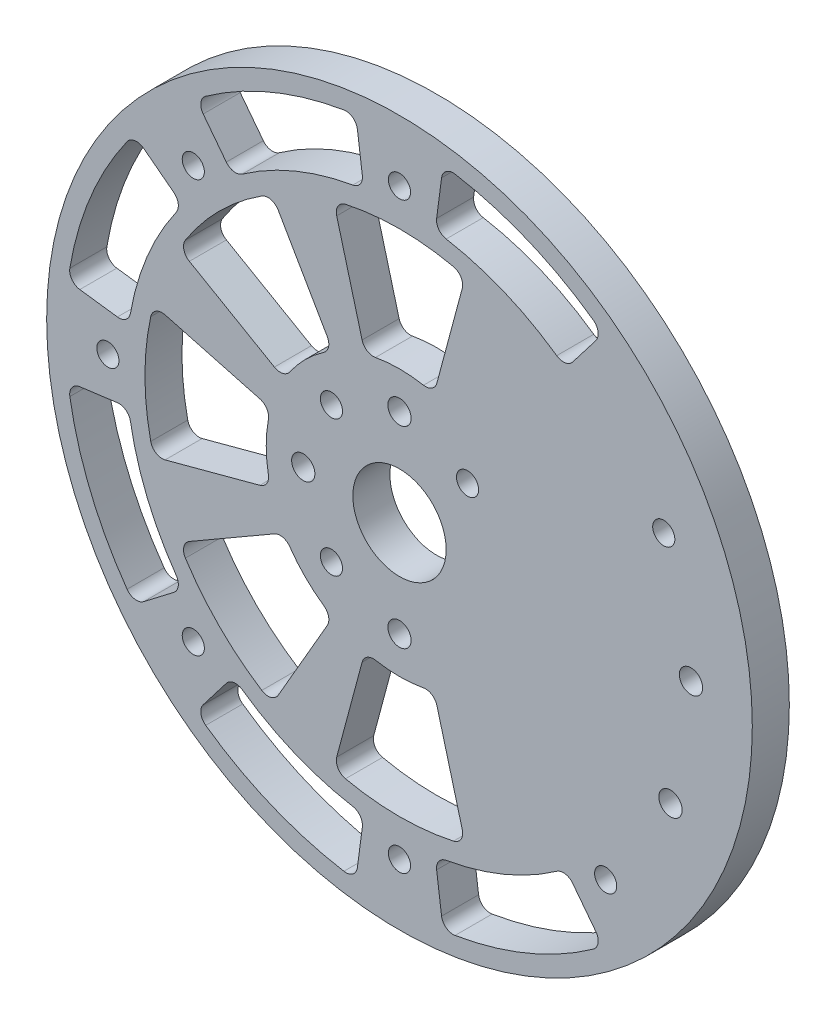
from build123d import *

# Parameters (mm, degrees)
SKETCH1_R                = 60.5
SKETCH1_R_2              = 1.89865
SKETCH1_R_3              = 1.9939
SKETCH1_R_4              = 8
BOSS_EXTRUDE1_DEPTH      = 6.35
CUT_EXTRUDE1_DEPTH       = 86.795235882
FILLET1_R                = 2
CIRPATTERN1_COUNT        = 8
FILLET1_OF_CIRPATTERN1_R = 2
CUT_EXTRUDE2_DEPTH       = 86.795235882
FILLET2_R                = 2
CIRPATTERN3_COUNT        = 8
FILLET2_OF_CIRPATTERN3_R = 2
SKETCH4_R                = 4.7625
SKETCH4_R_2              = 1.89865
CUT_EXTRUDE3_DEPTH       = 3.571875


with BuildPart() as part:
    # Sketch1 → Boss-Extrude1 (new body)
    with BuildSketch(Plane.XY):
        Circle(SKETCH1_R)
        with Locations((45.315389352, 21.130913087)):
            Circle(SKETCH1_R_2, mode=Mode.SUBTRACT)
        with Locations((49.978847504, 1.454235937)):
            Circle(SKETCH1_R_3, mode=Mode.SUBTRACT)
        Circle(SKETCH1_R_4, mode=Mode.SUBTRACT)
        with Locations((46.467376211, -18.460307366)):
            Circle(SKETCH1_R_3, mode=Mode.SUBTRACT)
        with Locations((0, -16.5)):
            Circle(SKETCH1_R_3, mode=Mode.SUBTRACT)
        with Locations((0, -50)):
            Circle(SKETCH1_R_2, mode=Mode.SUBTRACT)
        with Locations((-16.5, 0)):
            Circle(SKETCH1_R_3, mode=Mode.SUBTRACT)
        with Locations((-11.66726189, -11.66726189)):
            Circle(SKETCH1_R_2, mode=Mode.SUBTRACT)
        with Locations((0, 16.5)):
            Circle(SKETCH1_R_3, mode=Mode.SUBTRACT)
        with Locations((-11.66726189, 11.66726189)):
            Circle(SKETCH1_R_2, mode=Mode.SUBTRACT)
        with Locations((11.66726189, 11.66726189)):
            Circle(SKETCH1_R_2, mode=Mode.SUBTRACT)
        with Locations((-35.355339059, -35.355339059)):
            Circle(SKETCH1_R_2, mode=Mode.SUBTRACT)
        with Locations((-50, 0)):
            Circle(SKETCH1_R_2, mode=Mode.SUBTRACT)
        with Locations((-35.355339059, 35.355339059)):
            Circle(SKETCH1_R_2, mode=Mode.SUBTRACT)
        with Locations((0, 50)):
            Circle(SKETCH1_R_2, mode=Mode.SUBTRACT)
        with Locations((35.355339059, -35.355339059)):
            Circle(SKETCH1_R_2, mode=Mode.SUBTRACT)
    extrude(amount=BOSS_EXTRUDE1_DEPTH)

    # Sketch2 → Cut-Extrude1 (cut, through all)
    with BuildSketch(Plane.XY.offset(6.35)):
        with BuildLine():
            Line((-22.071405131, 5.914015181), (-42.162662318, 11.297451319))
            ThreePointArc((-42.162662318, 11.297451319), (-43.65, 0), (-42.162662318, -11.297451319))
            Line((-42.162662318, -11.297451319), (-22.071405131, -5.914015181))
            ThreePointArc((-22.071405131, -5.914015181), (-22.85, 0), (-22.071405131, 5.914015181))
        make_face()
    cut_extrude1 = extrude(amount=-CUT_EXTRUDE1_DEPTH, mode=Mode.SUBTRACT)

    # Fillet1
    fillet1_edges = [part.edges().sort_by_distance(p)[0] for p in [
        (-42.162662318, -11.297451319, 3.175),
        (-22.071405131, -5.914015181, 3.175),
        (-22.071405131, 5.914015181, 3.175),
        (-42.162662318, 11.297451319, 3.175),
    ]]
    fillet(fillet1_edges, radius=FILLET1_R)

    # CirPattern1: Cut-Extrude1 ×8 about axis, 3 skipped
    cirpattern1_axis = Axis((0, 0, 6.35), (0, 0, -1))
    add([cut_extrude1.rotate(cirpattern1_axis, i * 360 / CIRPATTERN1_COUNT) for i in range(1, CIRPATTERN1_COUNT) if i not in (3, 4, 5)], mode=Mode.SUBTRACT)

    # Fillet1 of CirPattern1
    fillet1_of_cirpattern1_edges = [part.edges().sort_by_distance(p)[0] for p in [
        (-37.802008875, 21.825, 3.175),
        (-19.788680476, 11.425, 3.175),
        (-11.425, 19.788680476, 3.175),
        (-21.825, 37.802008875, 3.175),
        (-11.297451319, 42.162662318, 3.175),
        (-5.914015181, 22.071405131, 3.175),
        (5.914015181, 22.071405131, 3.175),
        (11.297451319, 42.162662318, 3.175),
        (11.297451319, -42.162662318, 3.175),
        (5.914015181, -22.071405131, 3.175),
        (-5.914015181, -22.071405131, 3.175),
        (-11.297451319, -42.162662318, 3.175),
        (-21.825, -37.802008875, 3.175),
        (-11.425, -19.788680476, 3.175),
        (-19.788680476, -11.425, 3.175),
        (-37.802008875, -21.825, 3.175),
    ]]
    fillet(fillet1_of_cirpattern1_edges, radius=FILLET1_OF_CIRPATTERN1_R)

    # Sketch3 → Cut-Extrude2 (cut, through all)
    with BuildSketch(Plane.XY.offset(6.35)):
        with BuildLine():
            Line((-45.478980232, 34.897248918), (-37.148770159, 28.505253913))
            ThreePointArc((-37.148770159, 28.505253913), (-43.26065911, 17.91915172), (-46.424405634, 6.111888951))
            Line((-46.424405634, 6.111888951), (-56.834576678, 7.482413969))
            ThreePointArc((-56.834576678, 7.482413969), (-52.961394201, 21.93732776), (-45.478980232, 34.897248918))
        make_face()
    cut_extrude2 = extrude(amount=-CUT_EXTRUDE2_DEPTH, mode=Mode.SUBTRACT)

    # Fillet2
    fillet2_edges = [part.edges().sort_by_distance(p)[0] for p in [
        (-56.834576678, 7.482413969, 3.175),
        (-46.424405634, 6.111888951, 3.175),
        (-37.148770159, 28.505253913, 3.175),
        (-45.478980232, 34.897248918, 3.175),
    ]]
    fillet(fillet2_edges, radius=FILLET2_R)

    # CirPattern3: Cut-Extrude2 ×8 about axis, 2 skipped
    cirpattern3_axis = Axis((0, 0, 6.35), (0, 0, -1))
    add([cut_extrude2.rotate(cirpattern3_axis, i * 360 / CIRPATTERN3_COUNT) for i in range(1, CIRPATTERN3_COUNT) if i not in (3, 4)], mode=Mode.SUBTRACT)

    # Fillet2 of CirPattern3
    fillet2_of_cirpattern3_edges = [part.edges().sort_by_distance(p)[0] for p in [
        (-34.897248918, 45.478980232, 3.175),
        (-28.505253913, 37.148770159, 3.175),
        (-6.111888951, 46.424405634, 3.175),
        (-7.482413969, 56.834576678, 3.175),
        (7.482413969, 56.834576678, 3.175),
        (6.111888951, 46.424405634, 3.175),
        (28.505253913, 37.148770159, 3.175),
        (34.897248918, 45.478980232, 3.175),
        (34.897248918, -45.478980232, 3.175),
        (28.505253913, -37.148770159, 3.175),
        (6.111888951, -46.424405634, 3.175),
        (7.482413969, -56.834576678, 3.175),
        (-7.482413969, -56.834576678, 3.175),
        (-6.111888951, -46.424405634, 3.175),
        (-28.505253913, -37.148770159, 3.175),
        (-34.897248918, -45.478980232, 3.175),
        (-45.478980232, -34.897248918, 3.175),
        (-37.148770159, -28.505253913, 3.175),
        (-46.424405634, -6.111888951, 3.175),
        (-56.834576678, -7.482413969, 3.175),
    ]]
    fillet(fillet2_of_cirpattern3_edges, radius=FILLET2_OF_CIRPATTERN3_R)

    # Sketch4 → Cut-Extrude3 (cut)
    # profile 1 of 7: a face of its own
    with BuildSketch(Plane(origin=(0, 0, 0), x_dir=(-1, 0, 0), z_dir=(0, 0, -1))):
        with Locations((0, 50)):
            Circle(SKETCH4_R)
        with Locations((0, 50)):
            Circle(SKETCH4_R_2, mode=Mode.SUBTRACT)
    # profile 2 of 7: a face of its own
    with BuildSketch(Plane(origin=(0, 0, 0), x_dir=(-1, 0, 0), z_dir=(0, 0, -1))):
        with Locations((35.355339059, 35.355339059)):
            Circle(SKETCH4_R)
        with Locations((35.355339059, 35.355339059)):
            Circle(SKETCH4_R_2, mode=Mode.SUBTRACT)
    # profile 3 of 7: a face of its own
    with BuildSketch(Plane(origin=(0, 0, 0), x_dir=(-1, 0, 0), z_dir=(0, 0, -1))):
        with Locations((50, 0)):
            Circle(SKETCH4_R)
        with Locations((50, 0)):
            Circle(SKETCH4_R_2, mode=Mode.SUBTRACT)
    # profile 4 of 7: a face of its own
    with BuildSketch(Plane(origin=(0, 0, 0), x_dir=(-1, 0, 0), z_dir=(0, 0, -1))):
        with Locations((35.355339059, -35.355339059)):
            Circle(SKETCH4_R)
        with Locations((35.355339059, -35.355339059)):
            Circle(SKETCH4_R_2, mode=Mode.SUBTRACT)
    # profile 5 of 7: a face of its own
    with BuildSketch(Plane(origin=(0, 0, 0), x_dir=(-1, 0, 0), z_dir=(0, 0, -1))):
        with Locations((0, -50)):
            Circle(SKETCH4_R)
        with Locations((0, -50)):
            Circle(SKETCH4_R_2, mode=Mode.SUBTRACT)
    # profile 6 of 7: a face of its own
    with BuildSketch(Plane(origin=(0, 0, 0), x_dir=(-1, 0, 0), z_dir=(0, 0, -1))):
        with Locations((-35.355339059, -35.355339059)):
            Circle(SKETCH4_R)
        with Locations((-35.355339059, -35.355339059)):
            Circle(SKETCH4_R_2, mode=Mode.SUBTRACT)
    # profile 7 of 7: a face of its own
    with BuildSketch(Plane(origin=(0, 0, 0), x_dir=(-1, 0, 0), z_dir=(0, 0, -1))):
        with Locations((-45.315389352, 21.130913087)):
            Circle(SKETCH4_R)
        with Locations((-45.315389352, 21.130913087)):
            Circle(SKETCH4_R_2, mode=Mode.SUBTRACT)
    extrude(amount=-CUT_EXTRUDE3_DEPTH, mode=Mode.SUBTRACT)


solid = part.part
